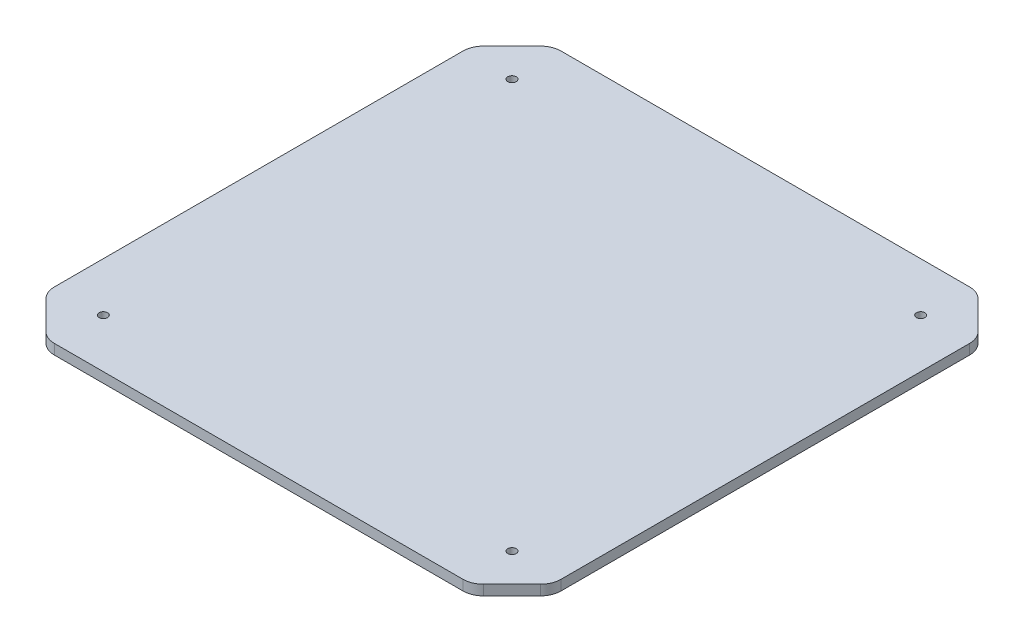
from build123d import *

# Parameters (mm, degrees)
SKETCH1_W           = 250
SKETCH1_H           = 250
BOSS_EXTRUDE1_DEPTH = 5
CHAMFER1_SIZE       = 20
FILLET2_R           = 10
SKETCH2_R           = 2.1
RF_HOLE_DEPTH       = 177.847391838


with BuildPart() as part:
    # Sketch1 → Boss-Extrude1 (new body)
    with BuildSketch(Plane(origin=(0, 0, 0), x_dir=(1, 0, 0), z_dir=(0, 1, 0))):
        Rectangle(SKETCH1_W, SKETCH1_H)
    extrude(amount=BOSS_EXTRUDE1_DEPTH)

    # Chamfer1
    chamfer1_edges = [part.edges().sort_by_distance(p)[0] for p in [
        (125, 2.5, -125),
        (125, 2.5, 125),
        (-125, 2.5, 125),
        (-125, 2.5, -125),
    ]]
    chamfer(chamfer1_edges, length=CHAMFER1_SIZE)

    # Fillet2
    fillet2_edges = [part.edges().sort_by_distance(p)[0] for p in [
        (125, 2.5, -105),
        (105, 2.5, -125),
        (-125, 2.5, -105),
        (-105, 2.5, -125),
        (105, 2.5, 125),
        (125, 2.5, 105),
        (-125, 2.5, 105),
        (-105, 2.5, 125),
    ]]
    fillet(fillet2_edges, radius=FILLET2_R)

    # Sketch2 → RF-Hole (cut, through all)
    with BuildSketch(Plane(origin=(0, 5, 0), x_dir=(1, 0, 0), z_dir=(0, 1, 0))):
        with Locations((-100.857864376, 100.857864376)):
            Circle(SKETCH2_R)
        with Locations((100.857864376, 100.857864376)):
            Circle(SKETCH2_R)
        with Locations((-100.857864376, -100.857864376)):
            Circle(SKETCH2_R)
        with Locations((100.857864376, -100.857864376)):
            Circle(SKETCH2_R)
    extrude(amount=-RF_HOLE_DEPTH, mode=Mode.SUBTRACT)


solid = part.part
